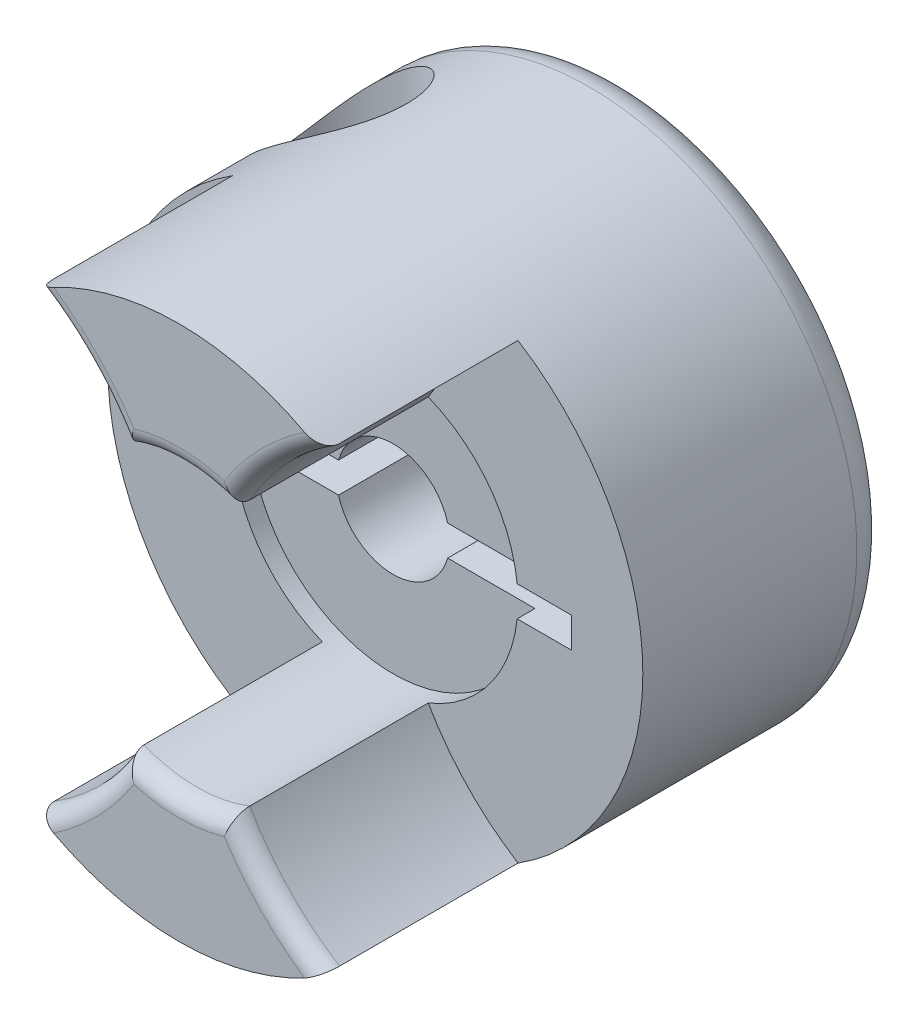
from build123d import *

# Parameters (mm, degrees)
SKETCH1_R               = 15
BOSS_EXTRUDE1_DEPTH     = 25
CUT_EXTRUDE1_DEPTH      = 11
SKETCH4_R               = 3.175
CUT_EXTRUDE2_DEPTH      = 14
SKETCH5_R               = 8
CUT_EXTRUDE3_DEPTH      = 1
SKETCH6_W               = 28.841933153
SKETCH6_H               = 1.7
CUT_EXTRUDE4_DEPTH      = 14
SKETCH7_W               = 7.940894739
SKETCH7_H               = 1.7
BOSS_EXTRUDE2_DEPTH     = 2
CHAMFER1_SIZE           = 11
CUT_EXTRUDE5_DEPTH      = 14
CUT_EXTRUDE5_DEPTH_BACK = 14
SKETCH8_R               = 2
SKETCH9_R               = 3.75
CUT_EXTRUDE6_DEPTH      = 11
FILLET1_R               = 2
FILLET2_R               = 1


with BuildPart() as part:
    # Sketch1 → Boss-Extrude1 (new body)
    with BuildSketch(Plane.XY):
        Circle(SKETCH1_R)
    extrude(amount=BOSS_EXTRUDE1_DEPTH)

    # Sketch3 → Cut-Extrude1 (cut)
    with BuildSketch(Plane.XY.offset(25)):
        with BuildLine():
            ThreePointArc((2.96875, -7.428763251), (31, 0), (2.96875, 7.428763251))
            ThreePointArc((2.96875, 7.428763251), (0, 8), (-2.96875, 7.428763251))
            ThreePointArc((-2.96875, 7.428763251), (-31, 0), (-2.96875, -7.428763251))
            ThreePointArc((-2.96875, -7.428763251), (0, -8), (2.96875, -7.428763251))
        make_face()
    extrude(amount=-CUT_EXTRUDE1_DEPTH, mode=Mode.SUBTRACT)

    # Sketch4 → Cut-Extrude2 (cut)
    with BuildSketch(Plane.XY.offset(14)):
        Circle(SKETCH4_R)
    extrude(amount=-CUT_EXTRUDE2_DEPTH, mode=Mode.SUBTRACT)

    # Sketch5 → Cut-Extrude3 (cut)
    with BuildSketch(Plane.XY.offset(14)):
        Circle(SKETCH5_R)
    extrude(amount=-CUT_EXTRUDE3_DEPTH, mode=Mode.SUBTRACT)

    # Sketch6 → Cut-Extrude4 (cut)
    with BuildSketch(Plane.XY.offset(14)):
        with Locations((-3.420966576, 0)):
            Rectangle(SKETCH6_W, SKETCH6_H)
    extrude(amount=-CUT_EXTRUDE4_DEPTH, mode=Mode.SUBTRACT)

    # Sketch7 → Boss-Extrude2 (add)
    with BuildSketch(Plane(origin=(0, 0, 0), x_dir=(-1, 0, 0), z_dir=(0, 0, -1))):
        with Locations((-7.02955263, 0)):
            Rectangle(SKETCH7_W, SKETCH7_H)
    extrude(amount=-BOSS_EXTRUDE2_DEPTH)

    # Chamfer1
    # the kernel refuses this chamfer: 11 mm, written as the material it adds along each edge
    with BuildSketch(Plane(origin=(11, -0.85, 2), x_dir=(0.027495876610586414, 0, 0.9996219169112968), z_dir=(0, 1, 0))) as chamfer1_piece_1_section:
        Polygon((CHAMFER1_SIZE * 0.999621916911, -CHAMFER1_SIZE * 0.0274958766106), (-CHAMFER1_SIZE * 0.0274958766106, -CHAMFER1_SIZE * 0.999621916911), (0, 0), align=None)
    chamfer1_piece_1 = extrude(amount=1.7, mode=Mode.PRIVATE)
    chamfer1_piece_1 = split(chamfer1_piece_1, bisect_by=Plane(origin=(3.059105261, 0, 5.913893193), z_dir=(1, 0, 0)), keep=Keep.TOP, mode=Mode.PRIVATE)
    add(chamfer1_piece_1)

    # Sketch8 → Cut-Extrude5 (cut, two sides: drawn at the far end of the back side and taken through both)
    with BuildSketch(Plane(origin=(0, 0, 0), x_dir=(1, 0, 0), z_dir=(0, 1, 0)).offset(-CUT_EXTRUDE5_DEPTH_BACK)):
        with Locations(Location((-9, -7, 0), (0, 0, 90))):
            Circle(SKETCH8_R)
    extrude(amount=CUT_EXTRUDE5_DEPTH + CUT_EXTRUDE5_DEPTH_BACK, mode=Mode.SUBTRACT)

    # Sketch9 → Cut-Extrude6 (cut)
    with BuildSketch(Plane(origin=(0, 15, 0), x_dir=(1, 0, 0), z_dir=(0, 1, 0))):
        with Locations(Location((-9, -7, 0), (0, 0, 270))):
            Circle(SKETCH9_R)
    extrude(amount=-CUT_EXTRUDE6_DEPTH, mode=Mode.SUBTRACT)

    # Fillet1
    fillet1_edges = [part.edges().sort_by_distance(p)[0] for p in [
        (15, 0, 0),
    ]]
    fillet(fillet1_edges, radius=FILLET1_R)

    # Fillet2
    fillet2_edges = [part.edges().sort_by_distance(p)[0] for p in [
        (-5.160499055, 10.368472369, 25),
        (0, -8, 25),
        (5.160499055, -10.368472369, 25),
        (0, 8, 25),
        (-5.160499055, -10.368472369, 25),
        (5.160499055, 10.368472369, 25),
    ]]
    fillet(fillet2_edges, radius=FILLET2_R)


solid = part.part
